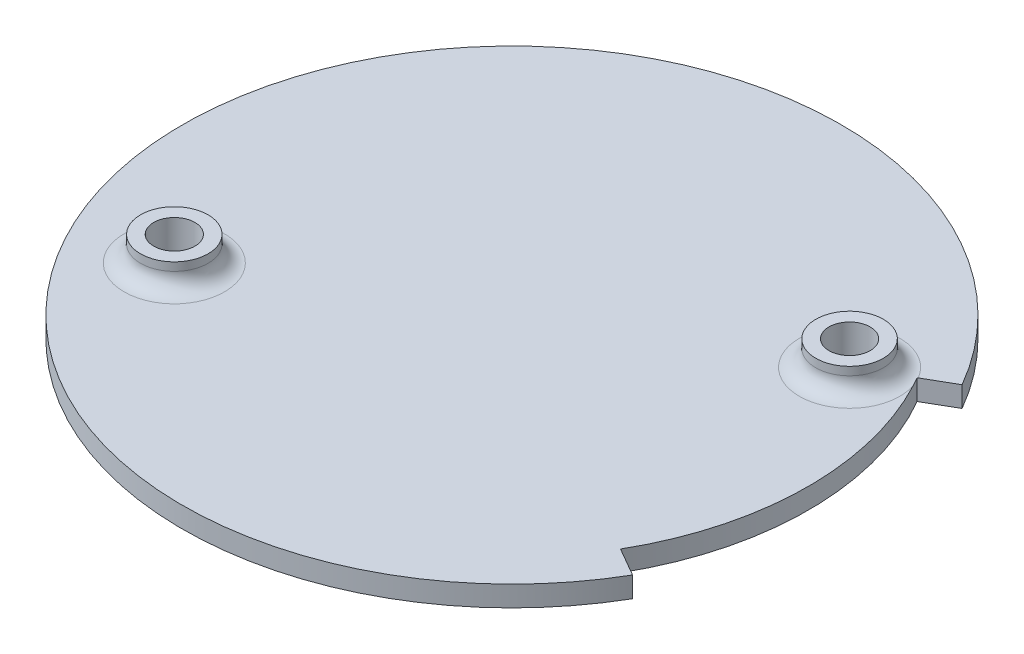
from build123d import *

# Parameters (mm, degrees)
SKETCH1_R            = 50.8
SKETCH1_R_2          = 48.8
SKETCH1_R_3          = 1.905
BOSS_EXTRUDE1_DEPTH  = 3.175
SKETCH3_R            = 50.8
SKETCH3_R_2          = 48.8
BOSS_EXTRUDE3_DEPTH  = 12.7
CUT_EXTRUDE1_DEPTH   = 73.955945611
FILLET2_R            = 6.35
SKETCH5_R            = 1.905
SKETCH5_W            = 16.479
SKETCH5_H            = 6
BOSS_EXTRUDE4_DEPTH  = 1
CUT_EXTRUDE2_DEPTH   = 74.575102096
BOSS_EXTRUDE5_DEPTH  = 12.7
SKETCH10_R           = 1.5
CUT_EXTRUDE4_DEPTH   = 73.95594575
BOSS_EXTRUDE7_START  = 12.7
SKETCH11_R           = 4.04
SKETCH11_R_2         = 1.5
BOSS_EXTRUDE7_DEPTH  = 12.7
BOSS_EXTRUDE8_START  = 38.1
BOSS_EXTRUDE8_DEPTH  = 38.1
FILLET4_R            = 3.175
BOSS_EXTRUDE9_DEPTH  = 15.24
SKETCH14_R           = 1.5
BOSS_EXTRUDE10_DEPTH = 3.175
CUT_EXTRUDE5_DEPTH   = 69.215
SKETCH16_R           = 3.175
CUT_EXTRUDE6_DEPTH   = 1.27
BOSS_EXTRUDE11_START = 3.81
SKETCH17_R           = 5.207
SKETCH17_R_2         = 3.175
BOSS_EXTRUDE11_DEPTH = 3.81
FILLET5_R            = 2.54
SKETCH18_R           = 1.65
CUT_EXTRUDE7_DEPTH   = 1.905


with BuildPart() as part:
    # Sketch1 → Boss-Extrude1 (new body)
    # profile 1 of 2: a face of its own
    with BuildSketch(Plane(origin=(0, 0, 0), x_dir=(1, 0, 0), z_dir=(0, 1, 0))):
        with Locations(Location((0, 0, 0), (0, 0, 270))):
            Circle(SKETCH1_R)
        Circle(SKETCH1_R_2, mode=Mode.SUBTRACT)
    # profile 2 of 2: a face of its own
    with BuildSketch(Plane(origin=(0, 0, 0), x_dir=(1, 0, 0), z_dir=(0, 1, 0))):
        Circle(SKETCH1_R_2)
        with Locations(Location((-13.1445, 33.02, 0), (0, 0, 270))):
            Circle(SKETCH1_R_3, mode=Mode.SUBTRACT)
        with Locations(Location((13.1445, 33.02, 0), (0, 0, 270))):
            Circle(SKETCH1_R_3, mode=Mode.SUBTRACT)
    extrude(amount=BOSS_EXTRUDE1_DEPTH)

    # Sketch3 → Boss-Extrude3 (add)
    with BuildSketch(Plane(origin=(0, 3.175, 0), x_dir=(1, 0, 0), z_dir=(0, 1, 0))):
        with Locations(Location((0, 0, 0), (0, 0, 270))):
            Circle(SKETCH3_R)
        with Locations(Location((0, 0, 0), (0, 0, 90))):
            Circle(SKETCH3_R_2, mode=Mode.SUBTRACT)
    extrude(amount=BOSS_EXTRUDE3_DEPTH)

    # Sketch4 → Cut-Extrude1 (cut, through all)
    with BuildSketch(Plane(origin=(0, 3.175, 0), x_dir=(1, 0, 0), z_dir=(0, 1, 0))):
        with BuildLine():
            Line((25.4, -38.01523905), (25.4, -20.834346642))
            add(Edge.make_bspline(
                [(-25.4, -20.834346642), (0, -32.254229315), (25.4, -20.834346642)],
                knots=[0, 0, 0, 1, 1, 1], degree=2))
            Line((-25.4, -20.834346642), (-25.4, -38.01523905))
            ThreePointArc((-25.4, -38.01523905), (0, -45.72), (25.4, -38.01523905))
        make_face()
    extrude(amount=-CUT_EXTRUDE1_DEPTH, mode=Mode.SUBTRACT)

    # Fillet2
    fillet2_edges = [part.edges().sort_by_distance(p)[0] for p in [
        (25.4, 1.5875, 20.834346642),
        (-25.4, 1.5875, 20.834346642),
        (-25.4, 1.5875, 38.01523905),
        (25.4, 1.5875, 38.01523905),
    ]]
    fillet(fillet2_edges, radius=FILLET2_R)

    # Sketch5 → Boss-Extrude4 (add)
    # profile 1 of 8: a face of its own
    with BuildSketch(Plane(origin=(0, 3.175, 0), x_dir=(1, 0, 0), z_dir=(0, 1, 0))):
        with BuildLine():
            Line((13.1445, 37.925), (-13.1445, 37.925))
            ThreePointArc((-13.1445, 37.925), (-9.676141238, 36.488358762), (-8.2395, 33.02))
            Line((-8.2395, 33.02), (-8.2395, 28.115))
            Line((-8.2395, 28.115), (8.2395, 28.115))
            Line((8.2395, 28.115), (8.2395, 33.02))
            ThreePointArc((8.2395, 33.02), (9.676141238, 36.488358762), (13.1445, 37.925))
        make_face()
    # profile 2 of 8: a face of its own
    with BuildSketch(Plane(origin=(0, 3.175, 0), x_dir=(1, 0, 0), z_dir=(0, 1, 0))):
        with BuildLine():
            ThreePointArc((-8.2395, 33.02), (-9.676141238, 36.488358762), (-13.1445, 37.925))
            ThreePointArc((-13.1445, 37.925), (-16.612858762, 36.488358762), (-18.0495, 33.02))
            ThreePointArc((-18.0495, 33.02), (-16.612858762, 29.551641238), (-13.1445, 28.115))
            ThreePointArc((-13.1445, 28.115), (-9.676141238, 29.551641238), (-8.2395, 33.02))
        make_face()
        with Locations(Location((-13.1445, 33.02, 0), (0, 0, 270))):
            Circle(SKETCH5_R, mode=Mode.SUBTRACT)
    # profile 3 of 8: a face of its own
    with BuildSketch(Plane(origin=(0, 3.175, 0), x_dir=(1, 0, 0), z_dir=(0, 1, 0))):
        with BuildLine():
            ThreePointArc((18.0495, 33.02), (16.612858762, 36.488358762), (13.1445, 37.925))
            ThreePointArc((13.1445, 37.925), (9.676141238, 36.488358762), (8.2395, 33.02))
            ThreePointArc((8.2395, 33.02), (9.676141238, 29.551641238), (13.1445, 28.115))
            ThreePointArc((13.1445, 28.115), (16.612858762, 29.551641238), (18.0495, 33.02))
        make_face()
        with Locations(Location((13.1445, 33.02, 0), (0, 0, 270))):
            Circle(SKETCH5_R, mode=Mode.SUBTRACT)
    # profile 4 of 8: a face of its own
    with BuildSketch(Plane(origin=(0, 3.175, 0), x_dir=(1, 0, 0), z_dir=(0, 1, 0))):
        with BuildLine():
            Line((-8.2395, 28.115), (-8.2395, 33.02))
            ThreePointArc((-8.2395, 33.02), (-9.676141238, 29.551641238), (-13.1445, 28.115))
            Line((-13.1445, 28.115), (-8.2395, 28.115))
        make_face()
    # profile 5 of 8: a face of its own
    with BuildSketch(Plane(origin=(0, 3.175, 0), x_dir=(1, 0, 0), z_dir=(0, 1, 0))):
        with BuildLine():
            ThreePointArc((-13.1445, 28.115), (-16.612858762, 29.551641238), (-18.0495, 33.02))
            Line((-18.0495, 33.02), (-18.0495, -23.729829016))
            add(Edge.make_bspline(
                [(-17.200482213, -23.925830908), (-17.339134534, -23.883616376), (-17.479112922, -23.845147844), (-17.620279441, -23.81048615), (-17.762494237, -23.779683986), (-17.905615595, -23.752786017), (-18.049499996, -23.729828993)],
                knots=[0, 0, 0, 0, 0, 0, 0, 0.074218898, 0.074218898, 0.074218898, 0.074218898, 0.074218898, 0.074218898, 0.074218898], degree=6))
            add(Edge.make_bspline(
                [(-17.200482213, -23.925830908), (-12.719991107, -25.289975642), (-8.2395, -25.943438167)],
                knots=[0.16140783, 0.16140783, 0.16140783, 0.337805118, 0.337805118, 0.337805118], degree=2))
            Line((-8.2395, -25.943438167), (-8.2395, -2.461719083))
            Line((-8.2395, -2.461719083), (-8.2395, 3.538280917))
            Line((-8.2395, 3.538280917), (-8.2395, 28.115))
            Line((-8.2395, 28.115), (-13.1445, 28.115))
        make_face()
    # profile 6 of 8: a face of its own
    with BuildSketch(Plane(origin=(0, 3.175, 0), x_dir=(1, 0, 0), z_dir=(0, 1, 0))):
        with BuildLine():
            Line((18.0495, -23.729829016), (18.0495, 33.02))
            ThreePointArc((18.0495, 33.02), (16.612858762, 29.551641238), (13.1445, 28.115))
            Line((13.1445, 28.115), (8.2395, 28.115))
            Line((8.2395, 28.115), (8.2395, 3.538280917))
            Line((8.2395, 3.538280917), (8.2395, -2.461719083))
            Line((8.2395, -2.461719083), (8.2395, -25.943438167))
            add(Edge.make_bspline(
                [(8.2395, -25.943438167), (12.719991107, -25.289975642), (17.200482213, -23.925830908)],
                knots=[0.662194882, 0.662194882, 0.662194882, 0.83859217, 0.83859217, 0.83859217], degree=2))
            add(Edge.make_bspline(
                [(18.049499996, -23.729828993), (17.905615595, -23.752786017), (17.762494237, -23.779683986), (17.620279441, -23.81048615), (17.479112922, -23.845147844), (17.339134534, -23.883616376), (17.200482213, -23.925830908)],
                knots=[0.925781102, 0.925781102, 0.925781102, 0.925781102, 0.925781102, 0.925781102, 0.925781102, 1, 1, 1, 1, 1, 1, 1], degree=6))
        make_face()
    # profile 7 of 8: a face of its own
    with BuildSketch(Plane(origin=(0, 3.175, 0), x_dir=(1, 0, 0), z_dir=(0, 1, 0))):
        with BuildLine():
            ThreePointArc((13.1445, 28.115), (9.676141238, 29.551641238), (8.2395, 33.02))
            Line((8.2395, 33.02), (8.2395, 28.115))
            Line((8.2395, 28.115), (13.1445, 28.115))
        make_face()
    # profile 8 of 8: a face of its own
    with BuildSketch(Plane(origin=(0, 3.175, 0), x_dir=(1, 0, 0), z_dir=(0, 1, 0))):
        with Locations((0, 0.538280917)):
            Rectangle(SKETCH5_W, SKETCH5_H)
    extrude(amount=BOSS_EXTRUDE4_DEPTH)

    # Sketch6 → Cut-Extrude2 (cut, through all)
    with BuildSketch(Plane(origin=(0, 15.875, 0), x_dir=(1, 0, 0), z_dir=(0, 1, 0))):
        with BuildLine():
            Line((42.262039705, 24.4), (39.594681461, 22.86))
            ThreePointArc((39.594681461, 22.86), (44.162128778, 11.833206742), (45.72, 0))
            Line((45.72, 0), (48.8, 0))
            ThreePointArc((48.8, 0), (47.137180323, 12.630369401), (42.262039705, 24.4))
        make_face()
        with BuildLine():
            ThreePointArc((45.72, 0), (44.162128778, -11.833206742), (39.594681461, -22.86))
            Line((39.594681461, -22.86), (42.262039705, -24.4))
            ThreePointArc((42.262039705, -24.4), (47.137180323, -12.630369401), (48.8, 0))
            Line((48.8, 0), (45.72, 0))
        make_face()
        with BuildLine():
            ThreePointArc((48.8, 0), (47.137180323, -12.630369401), (42.262039705, -24.4))
            Line((42.262039705, -24.4), (43.994090512, -25.4))
            ThreePointArc((43.994090512, -25.4), (49.069031975, -13.148007491), (50.8, 0))
            Line((50.8, 0), (48.8, 0))
        make_face()
        with BuildLine():
            Line((43.994090512, 25.4), (42.262039705, 24.4))
            ThreePointArc((42.262039705, 24.4), (47.137180323, 12.630369401), (48.8, 0))
            Line((48.8, 0), (50.8, 0))
            ThreePointArc((50.8, 0), (49.069031975, 13.148007491), (43.994090512, 25.4))
        make_face()
    extrude(amount=-CUT_EXTRUDE2_DEPTH, mode=Mode.SUBTRACT)

    # Sketch7 → Boss-Extrude5 (add)
    with BuildSketch(Plane(origin=(0, 3.175, 0), x_dir=(1, 0, 0), z_dir=(0, 1, 0))):
        with BuildLine():
            Line((42.262039705, -24.4), (39.594681461, -22.86))
            ThreePointArc((39.594681461, -22.86), (45.72, 0), (39.594681461, 22.86))
            Line((39.594681461, 22.86), (42.262039705, 24.4))
            ThreePointArc((42.262039705, 24.4), (41.753056776, 25.261081723), (41.226531944, 26.111550392))
            Line((41.226531944, 26.111550392), (36.822993007, 23.569166002))
            ThreePointArc((36.822993007, 23.569166002), (43.72, 0), (36.822993007, -23.569166002))
            Line((36.822993007, -23.569166002), (41.226531944, -26.111550392))
            ThreePointArc((41.226531944, -26.111550392), (41.753056776, -25.261081723), (42.262039705, -24.4))
        make_face()
    extrude(amount=BOSS_EXTRUDE5_DEPTH)

    # Sketch10 → Cut-Extrude4 (cut, through all)
    with BuildSketch(Plane(origin=(0, 3.175, 0), x_dir=(1, 0, 0), z_dir=(0, 1, 0))):
        with Locations(Location((-32.995567884, -19.05, 0), (0, 0, 270))):
            Circle(SKETCH10_R)
        with Locations(Location((32.995567884, 19.05, 0), (0, 0, 270))):
            Circle(SKETCH10_R)
    extrude(amount=-CUT_EXTRUDE4_DEPTH, mode=Mode.SUBTRACT)

    # Sketch11 → Boss-Extrude7 (add)
    # profile 1 of 3: a face of its own
    with BuildSketch(Plane(origin=(0, 3.175, 0), x_dir=(1, 0, 0), z_dir=(0, 1, 0)).offset(BOSS_EXTRUDE7_START)):
        with BuildLine():
            Line((37.125332322, 23.09), (32.995567884, 23.09))
            ThreePointArc((32.995567884, 23.09), (35.85227928, 21.906711396), (37.035567884, 19.05))
            ThreePointArc((37.035567884, 19.05), (35.85227928, 16.193288604), (32.995567884, 15.01))
            Line((32.995567884, 15.01), (41.062614383, 15.01))
            ThreePointArc((41.062614383, 15.01), (39.302167275, 19.151450272), (37.125332322, 23.09))
        make_face()
    # profile 2 of 3: a face of its own
    with BuildSketch(Plane(origin=(0, 3.175, 0), x_dir=(1, 0, 0), z_dir=(0, 1, 0)).offset(BOSS_EXTRUDE7_START)):
        with Locations((32.995567884, 19.05)):
            Circle(SKETCH11_R)
        with Locations(Location((32.995567884, 19.05, 0), (0, 0, 270))):
            Circle(SKETCH11_R_2, mode=Mode.SUBTRACT)
    # profile 3 of 3: a face of its own
    with BuildSketch(Plane(origin=(0, 3.175, 0), x_dir=(1, 0, 0), z_dir=(0, 1, 0)).offset(BOSS_EXTRUDE7_START)):
        with Locations(Location((-32.995567884, -19.05, 0), (0, 0, 270))):
            Circle(SKETCH11_R)
        with Locations(Location((-32.995567884, -19.05, 0), (0, 0, 270))):
            Circle(SKETCH11_R_2, mode=Mode.SUBTRACT)
    extrude(amount=-BOSS_EXTRUDE7_DEPTH)

    # Sketch12 → Boss-Extrude8 (add)
    with BuildSketch(Plane.XZ.offset(BOSS_EXTRUDE8_START)):
        with BuildLine():
            ThreePointArc((28.584071469, 41.995128982), (29.185832393, 29.185832393), (41.995128982, 28.584071469))
            ThreePointArc((41.995128982, 28.584071469), (35.921024484, 35.921024484), (28.584071469, 41.995128982))
        make_face()
        with BuildLine():
            ThreePointArc((28.584071469, -41.995128982), (35.921024484, -35.921024484), (41.995128982, -28.584071469))
            ThreePointArc((41.995128982, -28.584071469), (29.185832393, -29.185832393), (28.584071469, -41.995128982))
        make_face()
        with BuildLine():
            ThreePointArc((-41.995128982, 28.584071469), (-29.185832393, 29.185832393), (-28.584071469, 41.995128982))
            ThreePointArc((-28.584071469, 41.995128982), (-35.921024484, 35.921024484), (-41.995128982, 28.584071469))
        make_face()
        with BuildLine():
            ThreePointArc((-41.995128982, -28.584071469), (-35.921024484, -35.921024484), (-28.584071469, -41.995128982))
            ThreePointArc((-28.584071469, -41.995128982), (-29.185832393, -29.185832393), (-41.995128982, -28.584071469))
        make_face()
    extrude(amount=-BOSS_EXTRUDE8_DEPTH)

    # Fillet4
    fillet4_edges = [part.edges().sort_by_distance(p)[0] for p in [
        (41.995128982, -19.05, 28.584071469),
        (28.584071469, -19.05, 41.995128982),
        (28.584071469, -19.05, -41.995128982),
        (41.995128982, -19.05, -28.584071469),
        (-28.584071469, -19.05, 41.995128982),
        (-41.995128982, -19.05, 28.584071469),
        (-41.995128982, -19.05, -28.584071469),
        (-28.584071469, -19.05, -41.995128982),
    ]]
    fillet(fillet4_edges, radius=FILLET4_R)

    # Sketch13 → Boss-Extrude9 (add)
    with BuildSketch(Plane.XZ.offset(38.1)):
        Polygon((35.022998872, 35.022998872), (30.532870812, 39.513126933), (26.940768363, 35.921024484), (35.921024484, 26.940768363), (39.513126933, 30.532870812), align=None)
        Polygon((26.741716429, -35.72197255), (35.72197255, -26.741716429), (39.314074999, -30.333818878), (34.823946938, -34.823946938), (30.333818878, -39.314074999), align=None)
        Polygon((-35.921024484, -26.542664495), (-26.940768363, -35.522920616), (-30.532870812, -39.115023065), (-35.022998872, -34.624895004), (-39.513126933, -30.134766943), align=None)
        Polygon((-26.741716429, 36.120076418), (-35.72197255, 27.139820297), (-39.314074999, 30.731922746), (-34.823946938, 35.222050806), (-30.333818878, 39.712178867), align=None)
    extrude(amount=BOSS_EXTRUDE9_DEPTH)

    # Sketch14 → Boss-Extrude10 (add)
    # profile 1 of 2: a face of its own
    with BuildSketch(Plane(origin=(0, 15.875, 0), x_dir=(1, 0, 0), z_dir=(0, 1, 0))):
        with BuildLine():
            ThreePointArc((43.994090512, 25.4), (-50.8, 0), (43.994090512, -25.4))
            Line((43.994090512, -25.4), (39.594681461, -22.86))
            ThreePointArc((39.594681461, -22.86), (45.72, 0), (39.594681461, 22.86))
            Line((39.594681461, 22.86), (43.994090512, 25.4))
        make_face()
        with Locations(Location((32.995567884, 19.05, 0), (0, 0, 270))):
            Circle(SKETCH14_R, mode=Mode.SUBTRACT)
        with BuildLine():
            ThreePointArc((41.062614383, 15.01), (43.458370563, -4.775817), (36.822993007, -23.569166002))
            Line((36.822993007, -23.569166002), (41.226531944, -26.111550392))
            ThreePointArc((41.226531944, -26.111550392), (-48.8, 0), (41.226531944, 26.111550392))
            Line((41.226531944, 26.111550392), (36.822993007, 23.569166002))
            ThreePointArc((36.822993007, 23.569166002), (36.974938874, 23.330072766), (37.125332322, 23.09))
            Line((37.125332322, 23.09), (32.995567884, 23.09))
            ThreePointArc((32.995567884, 23.09), (28.955567884, 19.05), (32.995567884, 15.01))
            Line((32.995567884, 15.01), (41.062614383, 15.01))
        make_face(mode=Mode.SUBTRACT)
    # profile 2 of 2: a face of its own
    with BuildSketch(Plane(origin=(0, 15.875, 0), x_dir=(1, 0, 0), z_dir=(0, 1, 0))):
        with BuildLine():
            Line((36.822993007, -23.569166002), (41.226531944, -26.111550392))
            ThreePointArc((41.226531944, -26.111550392), (-48.8, 0), (41.226531944, 26.111550392))
            Line((41.226531944, 26.111550392), (36.822993007, 23.569166002))
            ThreePointArc((36.822993007, 23.569166002), (36.974938874, 23.330072766), (37.125332322, 23.09))
            Line((37.125332322, 23.09), (32.995567884, 23.09))
            ThreePointArc((32.995567884, 23.09), (28.955567884, 19.05), (32.995567884, 15.01))
            Line((32.995567884, 15.01), (41.062614383, 15.01))
            ThreePointArc((41.062614383, 15.01), (43.458370563, -4.775817), (36.822993007, -23.569166002))
        make_face()
        with Locations(Location((-32.995567884, -19.05, 0), (0, 0, 270))):
            Circle(SKETCH14_R, mode=Mode.SUBTRACT)
    extrude(amount=BOSS_EXTRUDE10_DEPTH)

    # Sketch15 → Cut-Extrude5 (cut)
    with BuildSketch(Plane.XZ.offset(53.34)):
        Polygon((-90.577857324, 69.263738682), (77.84239147, 62.337364813), (72.519121415, -67.102149145), (-95.901127379, -60.175775277), align=None)
    extrude(amount=-CUT_EXTRUDE5_DEPTH, mode=Mode.SUBTRACT)

    # Sketch16 → Cut-Extrude6 (cut)
    with BuildSketch(Plane(origin=(0, 19.05, 0), x_dir=(1, 0, 0), z_dir=(0, 1, 0))):
        with Locations(Location((-32.995567884, -19.05, 0), (0, 0, 270))):
            Circle(SKETCH16_R)
        with Locations(Location((32.995567884, 19.05, 0), (0, 0, 270))):
            Circle(SKETCH16_R)
    extrude(amount=-CUT_EXTRUDE6_DEPTH, mode=Mode.SUBTRACT)

    # Sketch17 → Boss-Extrude11 (add)
    # profile 1 of 2: a face of its own
    with BuildSketch(Plane(origin=(0, 19.05, 0), x_dir=(1, 0, 0), z_dir=(0, 1, 0)).offset(BOSS_EXTRUDE11_START)):
        with Locations(Location((-32.995567884, -19.05, 0), (0, 0, 90))):
            Circle(SKETCH17_R)
        with Locations(Location((-32.995567884, -19.05, 0), (0, 0, 270))):
            Circle(SKETCH17_R_2, mode=Mode.SUBTRACT)
    # profile 2 of 2: a face of its own
    with BuildSketch(Plane(origin=(0, 19.05, 0), x_dir=(1, 0, 0), z_dir=(0, 1, 0)).offset(BOSS_EXTRUDE11_START)):
        with Locations(Location((32.995567884, 19.05, 0), (0, 0, 90))):
            Circle(SKETCH17_R)
        with Locations(Location((32.995567884, 19.05, 0), (0, 0, 270))):
            Circle(SKETCH17_R_2, mode=Mode.SUBTRACT)
    extrude(amount=-BOSS_EXTRUDE11_DEPTH)

    # Fillet5
    # the kernel refuses this fillet: 2.54 mm, written as the material it adds along each edge
    with BuildSketch(Plane(origin=(-32.995567884, 19.05, 19.05), x_dir=(0, 0, -1), z_dir=(1, 0, 0))) as fillet5_piece_1:
        with BuildLine():
            CenterArc((5.207 + FILLET5_R, FILLET5_R), FILLET5_R, 180, 90)
            Line((5.207, FILLET5_R), (5.207, 0))
            Line((5.207, 0), (5.207 + FILLET5_R, 0))
        make_face()
    revolve(axis=Axis((-32.995567884, 19.05, 19.05), (0, 1, 0)))
    with BuildSketch(Plane(origin=(32.995567884, 19.05, -19.05), x_dir=(0, 0, -1), z_dir=(1, 0, 0))) as fillet5_piece_2_section:
        with BuildLine():
            CenterArc((5.207 + FILLET5_R, FILLET5_R), FILLET5_R, 180, 90)
            Line((5.207, FILLET5_R), (5.207, 0))
            Line((5.207, 0), (5.207 + FILLET5_R, 0))
        make_face()
    fillet5_piece_2 = revolve(axis=Axis((32.995567884, 19.05, -19.05), (0, 1, 0)), mode=Mode.PRIVATE)
    fillet5_piece_2 = split(fillet5_piece_2, bisect_by=Plane(origin=(30.427698254, 19.773240888, -17.567439778), z_dir=(-0.5000000000000018, 0, -0.8660254037844376)), keep=Keep.TOP, mode=Mode.PRIVATE)
    add(fillet5_piece_2)
    with BuildSketch(Plane(origin=(32.995567884, 19.05, -19.05), x_dir=(0, 0, -1), z_dir=(1, 0, 0))) as fillet5_piece_3_section:
        with BuildLine():
            CenterArc((5.207 + FILLET5_R, FILLET5_R), FILLET5_R, 180, 90)
            Line((5.207, FILLET5_R), (5.207, 0))
            Line((5.207, 0), (5.207 + FILLET5_R, 0))
        make_face()
    fillet5_piece_3 = revolve(axis=Axis((32.995567884, 19.05, -19.05), (0, 1, 0)), mode=Mode.PRIVATE)
    fillet5_piece_3 = fillet5_piece_3 & Plane(origin=(0, 19.77324089, 0), x_dir=(0.8660254037844378, 0, 0.5000000000000014), z_dir=(0, -1, 0)) * Cylinder(45.72, 31, mode=Mode.PRIVATE)
    add(fillet5_piece_3)

    # Sketch18 → Cut-Extrude7 (cut)
    with BuildSketch(Plane.XZ.offset(-15.875)):
        with Locations(Location((-32.995567884, 19.05, 0), (0, 0, 270))):
            Circle(SKETCH18_R)
        with Locations(Location((32.995567884, -19.05, 0), (0, 0, 270))):
            Circle(SKETCH18_R)
    extrude(amount=-CUT_EXTRUDE7_DEPTH, mode=Mode.SUBTRACT)


solid = part.part
